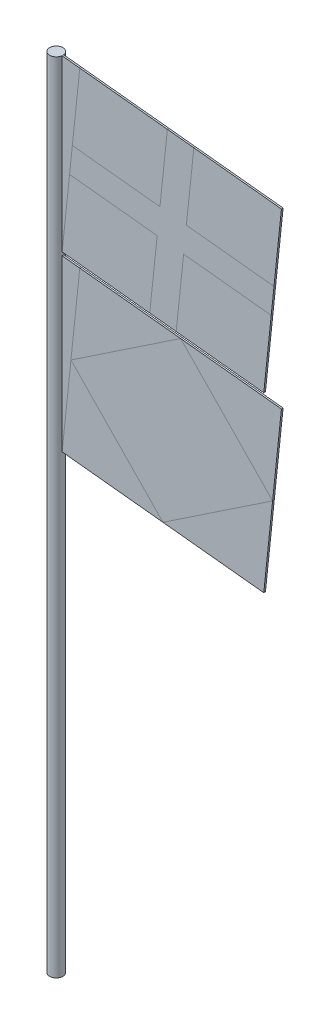
from build123d import *

# Parameters (mm, degrees)
BOSS_EXTRU_2_DEPTH             = 0.25
BOSS_EXTRU_2_2_DEPTH           = 0.25
FRACTIONNER1_START             = -0.25
FRACTIONNER1_DEPTH             = 0.5
FRACTIONNER1_2_DEPTH           = 0.5
FRACTIONNER1_START_2           = 7.435510802
FRACTIONNER1_3_OUTLINE_W       = 54
FRACTIONNER1_3_OUTLINE_H       = 4
FRACTIONNER1_3_DEPTH           = 5.341362776
FRACTIONNER1_START_3           = 1.989043791
FRACTIONNER1_4_OUTLINE_W       = 54
FRACTIONNER1_4_OUTLINE_H       = 4
FRACTIONNER1_4_DEPTH           = 5.341362776
FRACTIONNER2_SURFACE_1_1_BACK  = 128.911
FRACTIONNER2_SURFACE_1_1_DEPTH = 257.822
FRACTIONNER2_SURFACE_1_2_BACK  = 128.911
FRACTIONNER2_SURFACE_1_2_DEPTH = 257.822
FRACTIONNER2_SURFACE_2_3_BACK  = 128.911
FRACTIONNER2_SURFACE_2_3_DEPTH = 257.822
FRACTIONNER2_SURFACE_2_4_BACK  = 128.911
FRACTIONNER2_SURFACE_2_4_DEPTH = 257.822
FRACTIONNER2_SURFACE_3_5_BACK  = 128.911
FRACTIONNER2_SURFACE_3_5_DEPTH = 257.822
FRACTIONNER2_SURFACE_3_6_BACK  = 128.911
FRACTIONNER2_SURFACE_3_6_DEPTH = 257.822
FRACTIONNER2_SURFACE_4_7_BACK  = 128.911
FRACTIONNER2_SURFACE_4_7_DEPTH = 257.822
FRACTIONNER2_SURFACE_4_8_BACK  = 128.911
FRACTIONNER2_SURFACE_4_8_DEPTH = 257.822
FRACTIONNER3_SURFACE_9_BACK    = 128.911
FRACTIONNER3_SURFACE_9_DEPTH   = 257.822
FRACTIONNER3_SURFACE_10_BACK   = 128.911
FRACTIONNER3_SURFACE_10_DEPTH  = 257.822
BALAYAGE2_PROFILE_R            = 2


# Read off the part's stored shape, not the designer's step: Fractionner1
with BuildPart() as part:
    # Esquisse2 → Boss.-Extru.2 (new, symmetric)
    with BuildSketch(Plane.XY):
        Polygon((2, 0), (67.977937849, -6.934560702), (62.665835617, -57.475837352), (2, -51.099601093), align=None)
    extrude(amount=BOSS_EXTRU_2_DEPTH, both=True)

    # Fractionner1 4 outline → Fractionner1 4 (cut)
    with BuildSketch(Plane(origin=(0, 0, 0), x_dir=(0.10452846326764997, 0.9945218953682736, 0), z_dir=(0.9945218953682737, -0.10452846326764997, 0)).offset(FRACTIONNER1_START_3)):
        with Locations((-25, 0)):
            Rectangle(FRACTIONNER1_4_OUTLINE_W, FRACTIONNER1_4_OUTLINE_H)
    extrude(amount=FRACTIONNER1_4_DEPTH, mode=Mode.SUBTRACT)


with BuildPart() as body_2:
    # Esquisse2 → Boss.-Extru.2 2 (new, symmetric)
    with BuildSketch(Plane.XY):
        Polygon((2, -52.105109372), (67.977937849, -59.039670074), (62.665835617, -109.580946724), (2, -103.204710465), align=None)
    extrude(amount=BOSS_EXTRU_2_2_DEPTH, both=True)

    # Fractionner1 3 outline → Fractionner1 3 (cut)
    with BuildSketch(Plane(origin=(0, 0, 0), x_dir=(0.10452846326764997, 0.9945218953682736, 0), z_dir=(0.9945218953682737, -0.10452846326764997, 0)).offset(FRACTIONNER1_START_2)):
        with Locations((-77, 0)):
            Rectangle(FRACTIONNER1_3_OUTLINE_W, FRACTIONNER1_3_OUTLINE_H)
    extrude(amount=FRACTIONNER1_3_DEPTH, mode=Mode.SUBTRACT)


with BuildPart() as body_3:
    # Fractionner1 outline → Fractionner1 (new body)
    with BuildSketch(Plane.XY.offset(FRACTIONNER1_START)):
        Polygon((2, -51.099601093), (7.312102232, -0.558324443), (2, 0), align=None)
    extrude(amount=FRACTIONNER1_DEPTH)


with BuildPart() as body_4:
    # Fractionner1 2 outline → Fractionner1 2 (new body)
    with BuildSketch(Plane.XY.offset(FRACTIONNER1_START)):
        Polygon((2, -103.204710465), (7.312102232, -52.663433815), (2, -52.105109372), align=None)
    extrude(amount=FRACTIONNER1_2_DEPTH)


with BuildPart() as body_5:
    # Fractionner2: the piece behind the surface
    add(part.part)
    # Fractionner2 surface 1: a surface, the sketch's curves swept straight by 257.822 mm
    with BuildLine(Plane.XY.offset(0.25).offset(-FRACTIONNER2_SURFACE_1_1_BACK), mode=Mode.PRIVATE) as fractionner2_surface_1_1_path:
        Line((5.074164969, -21.850875186), (31.428995196, -24.620879463))
        Line((31.428995196, -24.620879463), (33.666932459, -3.328328719))
    fractionner2_surface_1_1 = Shell.extrude(fractionner2_surface_1_1_path.wire(), (0 * FRACTIONNER2_SURFACE_1_1_DEPTH, 0 * FRACTIONNER2_SURFACE_1_1_DEPTH, 1 * FRACTIONNER2_SURFACE_1_1_DEPTH))
    split(bisect_by=fractionner2_surface_1_1, keep=Keep.BOTTOM)


with BuildPart() as part_1:
    add(part.part)

    # Fractionner2: split by a surface, the side it looks to stays
    # Fractionner2 surface 1: a surface, the sketch's curves swept straight by 257.822 mm
    with BuildLine(Plane.XY.offset(0.25).offset(-FRACTIONNER2_SURFACE_1_2_BACK), mode=Mode.PRIVATE) as fractionner2_surface_1_2_path:
        Line((5.074164969, -21.850875186), (31.428995196, -24.620879463))
        Line((31.428995196, -24.620879463), (33.666932459, -3.328328719))
    fractionner2_surface_1_2 = Shell.extrude(fractionner2_surface_1_2_path.wire(), (0 * FRACTIONNER2_SURFACE_1_2_DEPTH, 0 * FRACTIONNER2_SURFACE_1_2_DEPTH, 1 * FRACTIONNER2_SURFACE_1_2_DEPTH))
    split(bisect_by=fractionner2_surface_1_2, keep=Keep.TOP)


with BuildPart() as body_6:
    # Fractionner2 2 body 5: the piece behind the surface
    add(body_5.part)
    # Fractionner2 surface 2: a surface, the sketch's curves swept straight by 257.822 mm
    with BuildLine(Plane.XY.offset(0.25).offset(-FRACTIONNER2_SURFACE_2_3_BACK), mode=Mode.PRIVATE) as fractionner2_surface_2_3_path:
        Line((41.623107622, -4.164556425), (39.385170359, -25.457107169))
        Line((39.385170359, -25.457107169), (65.740000586, -28.227111445))
    fractionner2_surface_2_3 = Shell.extrude(fractionner2_surface_2_3_path.wire(), (0 * FRACTIONNER2_SURFACE_2_3_DEPTH, 0 * FRACTIONNER2_SURFACE_2_3_DEPTH, 1 * FRACTIONNER2_SURFACE_2_3_DEPTH))
    split(bisect_by=fractionner2_surface_2_3, keep=Keep.BOTTOM)


with BuildPart() as body_5_1:
    add(body_5.part)

    # Fractionner2 2 body 5: split by a surface, the side it looks to stays
    # Fractionner2 surface 2: a surface, the sketch's curves swept straight by 257.822 mm
    with BuildLine(Plane.XY.offset(0.25).offset(-FRACTIONNER2_SURFACE_2_4_BACK), mode=Mode.PRIVATE) as fractionner2_surface_2_4_path:
        Line((41.623107622, -4.164556425), (39.385170359, -25.457107169))
        Line((39.385170359, -25.457107169), (65.740000586, -28.227111445))
    fractionner2_surface_2_4 = Shell.extrude(fractionner2_surface_2_4_path.wire(), (0 * FRACTIONNER2_SURFACE_2_4_DEPTH, 0 * FRACTIONNER2_SURFACE_2_4_DEPTH, 1 * FRACTIONNER2_SURFACE_2_4_DEPTH))
    split(bisect_by=fractionner2_surface_2_4, keep=Keep.TOP)


with BuildPart() as body_7:
    # Fractionner2 3 body 6: the piece behind the surface
    add(body_6.part)
    # Fractionner2 surface 3: a surface, the sketch's curves swept straight by 257.822 mm
    with BuildLine(Plane.XY.offset(0.25).offset(-FRACTIONNER2_SURFACE_3_5_BACK), mode=Mode.PRIVATE) as fractionner2_surface_3_5_path:
        Line((64.90377288, -36.183286608), (38.548942653, -33.413282332))
        Line((38.548942653, -33.413282332), (36.31100539, -54.705833075))
    fractionner2_surface_3_5 = Shell.extrude(fractionner2_surface_3_5_path.wire(), (0 * FRACTIONNER2_SURFACE_3_5_DEPTH, 0 * FRACTIONNER2_SURFACE_3_5_DEPTH, 1 * FRACTIONNER2_SURFACE_3_5_DEPTH))
    split(bisect_by=fractionner2_surface_3_5, keep=Keep.BOTTOM)


with BuildPart() as body_6_1:
    add(body_6.part)

    # Fractionner2 3 body 6: split by a surface, the side it looks to stays
    # Fractionner2 surface 3: a surface, the sketch's curves swept straight by 257.822 mm
    with BuildLine(Plane.XY.offset(0.25).offset(-FRACTIONNER2_SURFACE_3_6_BACK), mode=Mode.PRIVATE) as fractionner2_surface_3_6_path:
        Line((64.90377288, -36.183286608), (38.548942653, -33.413282332))
        Line((38.548942653, -33.413282332), (36.31100539, -54.705833075))
    fractionner2_surface_3_6 = Shell.extrude(fractionner2_surface_3_6_path.wire(), (0 * FRACTIONNER2_SURFACE_3_6_DEPTH, 0 * FRACTIONNER2_SURFACE_3_6_DEPTH, 1 * FRACTIONNER2_SURFACE_3_6_DEPTH))
    split(bisect_by=fractionner2_surface_3_6, keep=Keep.TOP)


with BuildPart() as body_8:
    # Fractionner2 4 body 7: the piece behind the surface
    add(body_7.part)
    # Fractionner2 surface 4: a surface, the sketch's curves swept straight by 257.822 mm
    with BuildLine(Plane.XY.offset(0.25).offset(-FRACTIONNER2_SURFACE_4_7_BACK), mode=Mode.PRIVATE) as fractionner2_surface_4_7_path:
        Line((28.354830227, -53.869605369), (30.59276749, -32.577054626))
        Line((30.59276749, -32.577054626), (4.237937263, -29.807050349))
    fractionner2_surface_4_7 = Shell.extrude(fractionner2_surface_4_7_path.wire(), (0 * FRACTIONNER2_SURFACE_4_7_DEPTH, 0 * FRACTIONNER2_SURFACE_4_7_DEPTH, 1 * FRACTIONNER2_SURFACE_4_7_DEPTH))
    split(bisect_by=fractionner2_surface_4_7, keep=Keep.BOTTOM)


with BuildPart() as body_7_1:
    add(body_7.part)

    # Fractionner2 4 body 7: split by a surface, the side it looks to stays
    # Fractionner2 surface 4: a surface, the sketch's curves swept straight by 257.822 mm
    with BuildLine(Plane.XY.offset(0.25).offset(-FRACTIONNER2_SURFACE_4_8_BACK), mode=Mode.PRIVATE) as fractionner2_surface_4_8_path:
        Line((28.354830227, -53.869605369), (30.59276749, -32.577054626))
        Line((30.59276749, -32.577054626), (4.237937263, -29.807050349))
    fractionner2_surface_4_8 = Shell.extrude(fractionner2_surface_4_8_path.wire(), (0 * FRACTIONNER2_SURFACE_4_8_DEPTH, 0 * FRACTIONNER2_SURFACE_4_8_DEPTH, 1 * FRACTIONNER2_SURFACE_4_8_DEPTH))
    split(bisect_by=fractionner2_surface_4_8, keep=Keep.TOP)


with BuildPart() as body_9:
    # Fractionner3: the piece behind the surface
    add(body_2.part)
    # Fractionner3 surface: a surface, the sketch's curves swept straight by 257.822 mm
    with BuildLine(Plane.XY.offset(0.25).offset(-FRACTIONNER3_SURFACE_9_BACK), mode=Mode.PRIVATE) as fractionner3_surface_9_path:
        Line((37.64502004, -55.851551945), (4.656051116, -77.93407214))
        Line((4.656051116, -77.93407214), (32.332917809, -106.392828594))
        Line((32.332917809, -106.392828594), (65.321886733, -84.310308399))
        Line((65.321886733, -84.310308399), (37.64502004, -55.851551945))
    fractionner3_surface_9 = Shell.extrude(fractionner3_surface_9_path.wire(), (0 * FRACTIONNER3_SURFACE_9_DEPTH, 0 * FRACTIONNER3_SURFACE_9_DEPTH, 1 * FRACTIONNER3_SURFACE_9_DEPTH))
    split(bisect_by=fractionner3_surface_9, keep=Keep.BOTTOM)


with BuildPart() as body_2_1:
    add(body_2.part)

    # Fractionner3: split by a surface, the side it looks to stays
    # Fractionner3 surface: a surface, the sketch's curves swept straight by 257.822 mm
    with BuildLine(Plane.XY.offset(0.25).offset(-FRACTIONNER3_SURFACE_10_BACK), mode=Mode.PRIVATE) as fractionner3_surface_10_path:
        Line((37.64502004, -55.851551945), (4.656051116, -77.93407214))
        Line((4.656051116, -77.93407214), (32.332917809, -106.392828594))
        Line((32.332917809, -106.392828594), (65.321886733, -84.310308399))
        Line((65.321886733, -84.310308399), (37.64502004, -55.851551945))
    fractionner3_surface_10 = Shell.extrude(fractionner3_surface_10_path.wire(), (0 * FRACTIONNER3_SURFACE_10_DEPTH, 0 * FRACTIONNER3_SURFACE_10_DEPTH, 1 * FRACTIONNER3_SURFACE_10_DEPTH))
    split(bisect_by=fractionner3_surface_10, keep=Keep.TOP)


with BuildPart() as body_10:
    # Balayage2: sweep along a path in Esquisse7
    with BuildLine(Plane.XY) as balayage2_path:
        Line((0, 0), (0, -240))
    # Balayage2 profile (on start of the path) → Balayage2 (sweep)
    with BuildSketch(Plane(origin=(0, 0, 0), x_dir=(-1, 0, 0), z_dir=(0, -1, 0))):
        Circle(BALAYAGE2_PROFILE_R)
    sweep(path=balayage2_path.line)


solid = Compound([body_3.part, body_4.part, part_1.part, body_5_1.part, body_6_1.part, body_8.part, body_7_1.part, body_9.part, body_2_1.part, body_10.part])
